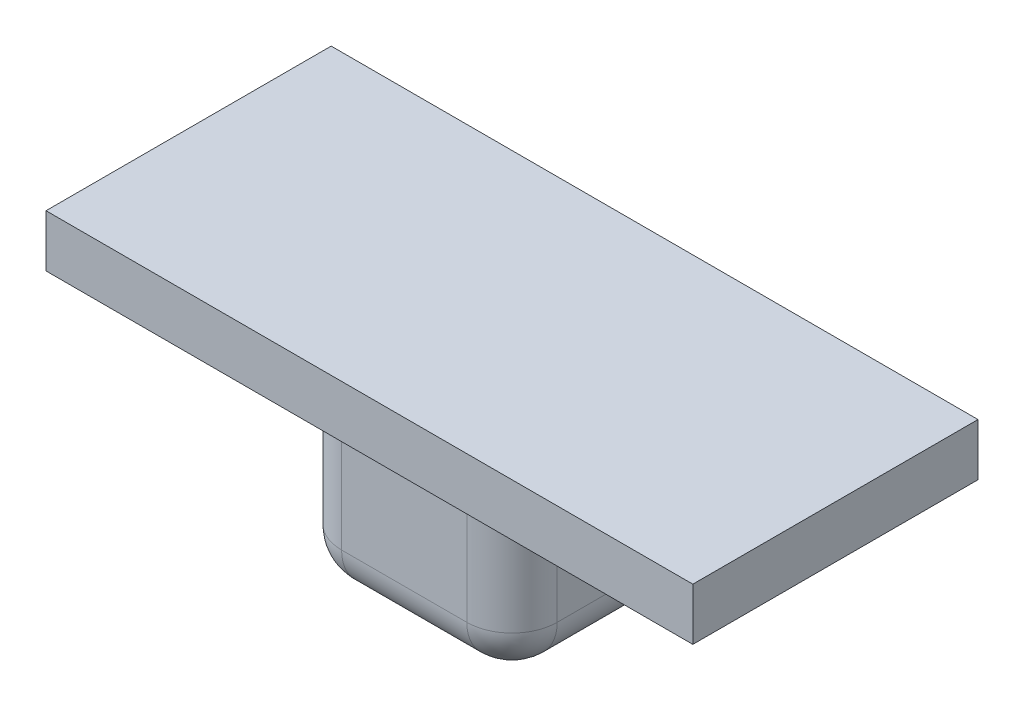
from build123d import *

# Parameters (mm, degrees)
SKETCH_1_W      = 6.2
SKETCH_1_H      = 6.2
SKETCH_1_W_2    = 3.2
SKETCH_1_H_2    = 3.2
EXTRUDE_1_DEPTH = 5
SKETCH_4_W      = 18.6
SKETCH_4_H      = 8.2
EXTRUDE_3_DEPTH = 1.5
FILLET_2_R      = 1.3


with BuildPart() as part:
    # Эскиз1 → Бобышка-Вытянуть1 (new body)
    with BuildSketch(Plane(origin=(0, 0, 0), x_dir=(1, 0, 0), z_dir=(0, 1, 0))):
        Rectangle(SKETCH_1_W, SKETCH_1_H)
        Rectangle(SKETCH_1_W_2, SKETCH_1_H_2, mode=Mode.SUBTRACT)
    extrude(amount=EXTRUDE_1_DEPTH)

    # Эскиз4 → Бобышка-Вытянуть3 (add)
    with BuildSketch(Plane(origin=(0, 5, 0), x_dir=(1, 0, 0), z_dir=(0, 1, 0))):
        Rectangle(SKETCH_4_W, SKETCH_4_H)
    extrude(amount=EXTRUDE_3_DEPTH)

    # Скругление2
    fillet_2_edges = [part.edges().sort_by_distance(p)[0] for p in [
        (3.1, 2.5, -3.1),
        (3.1, 2.5, 3.1),
        (-3.1, 2.5, -3.1),
        (-3.1, 2.5, 3.1),
        (0, 0, -3.1),
        (3.1, 0, 0),
        (0, 0, 3.1),
        (-3.1, 0, 0),
    ]]
    fillet(fillet_2_edges, radius=FILLET_2_R)


solid = part.part
